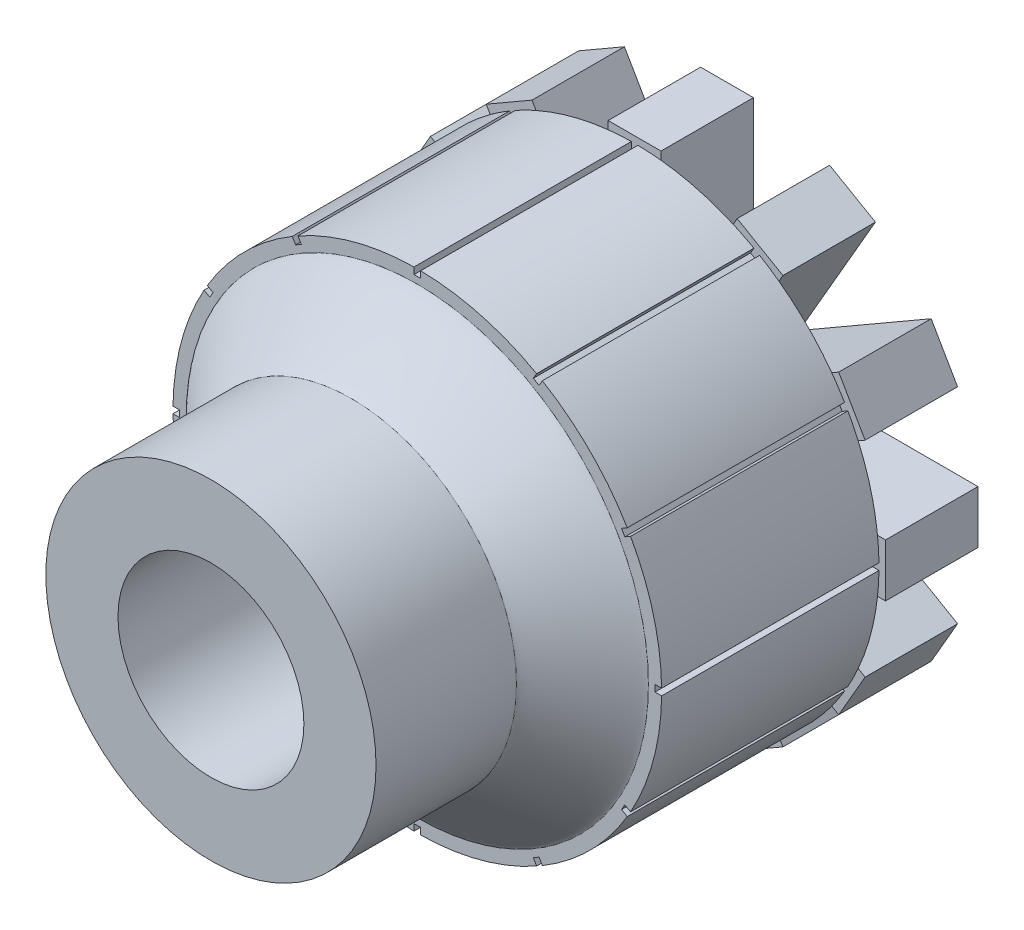
from build123d import *

# Parameters (mm, degrees)
SKETCH1_R               = 9.398
BOSS_EXTRUDE1_DEPTH     = 16.2941
SKETCH2_OUTSIDE_W       = 27.032
SKETCH2_OUTSIDE_H       = 27.032
SKETCH2_OUTSIDE_R       = 6.35
CUT_EXTRUDE1_DEPTH      = 7.9375
FILLET1_SIZE            = 2.54
SKETCH3_W               = 19.304
SKETCH3_H               = 2.032
BOSS_EXTRUDE2_DEPTH     = 3.556
CIRPATTERN1_COUNT       = 12
CUT_EXTRUDE2_START      = -9.398
SKETCH5_W               = 10.16
SKETCH5_H               = 0.254
CUT_EXTRUDE2_DEPTH      = 0.254
CIRPATTERN2_COUNT       = 12
CUT_EXTRUDE3_DEPTH      = 25.090427103
CUT_EXTRUDE3_DEPTH_BACK = 25.090427103
SKETCH6_R               = 3.57505


with BuildPart() as part:
    # Sketch1 → Boss-Extrude1 (new body)
    with BuildSketch(Plane.XY):
        Circle(SKETCH1_R)
    extrude(amount=BOSS_EXTRUDE1_DEPTH)

    # Sketch2 outside → Cut-Extrude1 (cut)
    with BuildSketch(Plane.XY.offset(16.2941)):
        Rectangle(SKETCH2_OUTSIDE_W, SKETCH2_OUTSIDE_H)
        Circle(SKETCH2_OUTSIDE_R, mode=Mode.SUBTRACT)
    extrude(amount=-CUT_EXTRUDE1_DEPTH, mode=Mode.SUBTRACT)

    # Fillet1
    # a fillet whose section is not a circle: 2.54 mm, written as the material it adds along each edge
    with BuildSketch(Plane(origin=(0, 0, 8.3566), x_dir=(1, 0, 0), z_dir=(0, -1, 0))) as fillet1_piece_1:
        with BuildLine():
            Bezier((6.35 + FILLET1_SIZE, 0), (6.35, 0), (6.35, FILLET1_SIZE), weights=[1, 0.047339252, 1])
            Line((6.35, FILLET1_SIZE), (6.35, 0))
            Line((6.35, 0), (6.35 + FILLET1_SIZE, 0))
        make_face()
    revolve(axis=Axis((0, 0, 8.3566), (0, 0, 1)))

    # Sketch3 → Boss-Extrude2 (add)
    with BuildSketch(Plane(origin=(0, 0, 0), x_dir=(-1, 0, 0), z_dir=(0, 0, -1))):
        Rectangle(SKETCH3_W, SKETCH3_H)
    boss_extrude2 = extrude(amount=BOSS_EXTRUDE2_DEPTH)

    # CirPattern1: Boss-Extrude2 ×12 about axis
    cirpattern1_axis = Axis((0, 0, 0), (0, 0, 1))
    for i in range(1, CIRPATTERN1_COUNT):
        add(boss_extrude2.rotate(cirpattern1_axis, i * 360 / CIRPATTERN1_COUNT))

    # Sketch5 → Cut-Extrude2 (cut)
    with BuildSketch(Plane(origin=(0, 0, 0), x_dir=(0, 0, -1), z_dir=(1, 0, 0)).offset(CUT_EXTRUDE2_START)):
        with Locations((-5.08, 0)):
            Rectangle(SKETCH5_W, SKETCH5_H)
    cut_extrude2 = extrude(amount=CUT_EXTRUDE2_DEPTH, mode=Mode.SUBTRACT)

    # CirPattern2: Cut-Extrude2 ×12 about axis
    cirpattern2_axis = Axis((0, 0, 0), (0, 0, 1))
    for i in range(1, CIRPATTERN2_COUNT):
        add(cut_extrude2.rotate(cirpattern2_axis, i * 360 / CIRPATTERN2_COUNT), mode=Mode.SUBTRACT)

    # Sketch6 → Cut-Extrude3 (cut, two sides: drawn at the far end of the back side and taken through both)
    with BuildSketch(Plane.XY.offset(16.2941).offset(-CUT_EXTRUDE3_DEPTH_BACK)):
        Circle(SKETCH6_R)
    extrude(amount=CUT_EXTRUDE3_DEPTH + CUT_EXTRUDE3_DEPTH_BACK, mode=Mode.SUBTRACT)


solid = part.part
